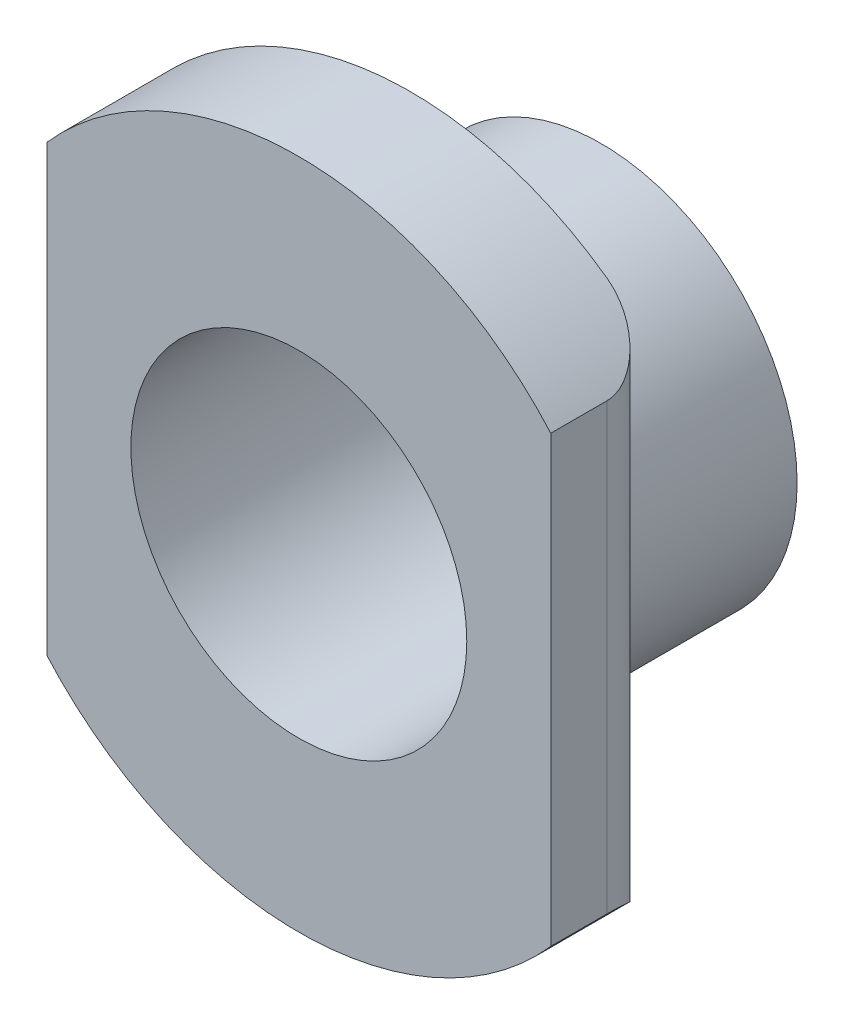
from build123d import *

# Parameters (mm, degrees)
SKETCH_1_R      = 1.75
SKETCH_1_R_2    = 1.5
EXTRUDE_1_DEPTH = 1.7
SKETCH_2_R      = 1.75
SKETCH_2_R_2    = 1.5
EXTRUDE_2_DEPTH = 1
FILLET_1_R      = 0.5


with BuildPart() as part:
    # 草图1 → 凸台-拉伸1 (new body)
    with BuildSketch(Plane.XY):
        Circle(SKETCH_1_R)
        Circle(SKETCH_1_R_2, mode=Mode.SUBTRACT)
    extrude(amount=EXTRUDE_1_DEPTH)

    # 草图2 → 凸台-拉伸2 (add)
    # profile 1 of 2: a face of its own
    with BuildSketch(Plane.XY.offset(1.7)):
        with BuildLine():
            ThreePointArc((-2.25, -1.984313483), (-1.234313483, -2.734313483), (0, -3))
            ThreePointArc((0, -3), (1.234313483, -2.734313483), (2.25, -1.984313483))
            Line((2.25, -1.984313483), (2.25, 1.984313483))
            ThreePointArc((2.25, 1.984313483), (1.234313483, 2.734313483), (0, 3))
            ThreePointArc((0, 3), (-1.234313483, 2.734313483), (-2.25, 1.984313483))
            Line((-2.25, 1.984313483), (-2.25, -1.984313483))
        make_face()
        Circle(SKETCH_2_R, mode=Mode.SUBTRACT)
    # profile 2 of 2: a face of its own
    with BuildSketch(Plane.XY.offset(1.7)):
        Circle(SKETCH_2_R)
        Circle(SKETCH_2_R_2, mode=Mode.SUBTRACT)
    extrude(amount=EXTRUDE_2_DEPTH)

    # 圆角1
    fillet_1_edges = [part.edges().sort_by_distance(p)[0] for p in [
        (2.25, 0, 1.7),
    ]]
    fillet(fillet_1_edges, radius=FILLET_1_R - 0.0001)  # a hair under: the kernel refuses the full size


solid = part.part
